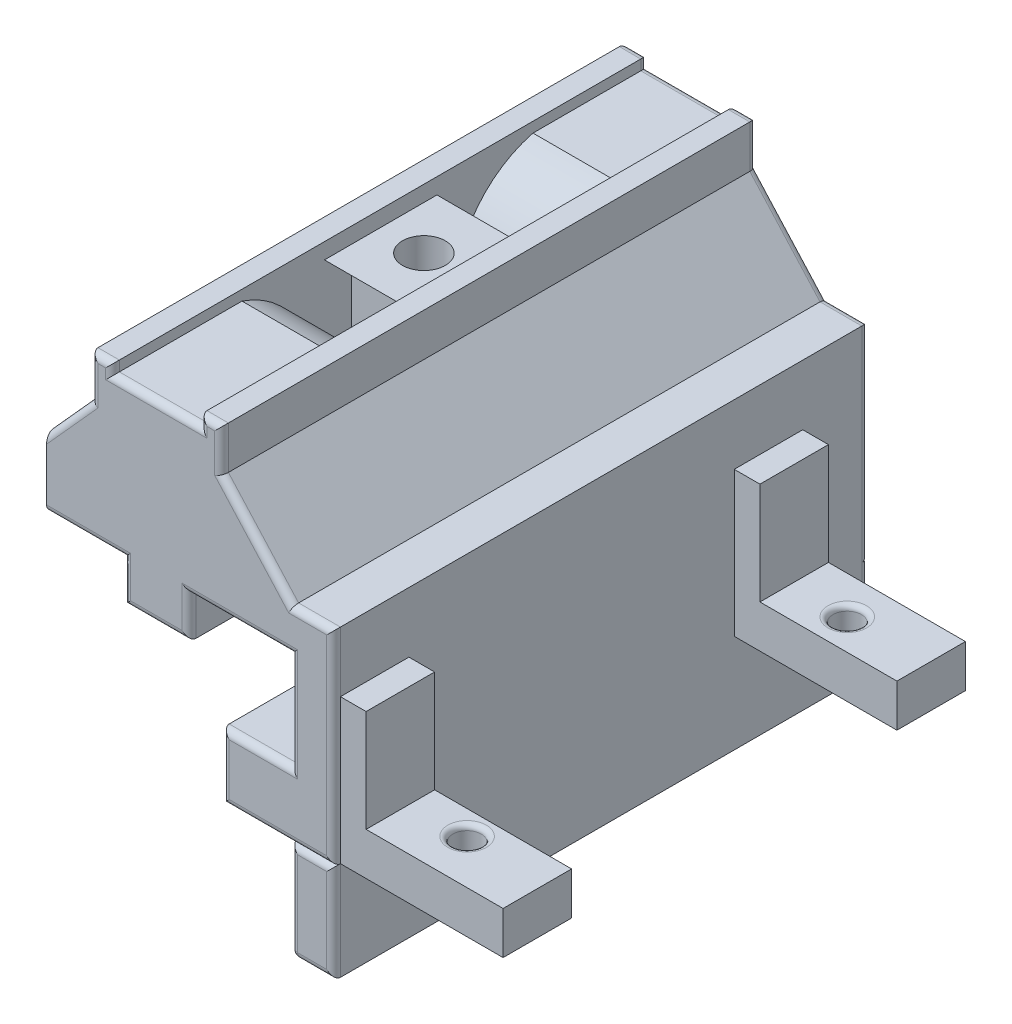
from build123d import *

# Parameters (mm, degrees)
BOSS_EXTRUDE1_DEPTH      = 39.6875
SKETCH3_R                = 1.5875
CUT_EXTRUDE1_DEPTH       = 39.6875
CUT_EXTRUDE3_DEPTH       = 5
CUT_EXTRUDE5_DEPTH       = 0.83
CUT_EXTRUDE5_DEPTH_BACK  = 5.67
FILLET1_R                = 0.508
SKETCH7_W                = 5.08
SKETCH7_H                = 10.72628101
BOSS_EXTRUDE2_DEPTH      = 1.905
SKETCH8_W                = 5.08
SKETCH8_H                = 3.15692897
BOSS_EXTRUDE3_DEPTH      = 10.16
CUT_EXTRUDE7_REACH       = 54.859
SKETCH9_R                = 1.05
FILLET2_R                = 0.381
CUT_EXTRUDE8_DEPTH       = 53.05177524
BOSS_EXTRUDE4_DEPTH      = 0.508
BOSS_EXTRUDE4_DEPTH_BACK = 39.1795
SKETCH11_W               = 3.175
SKETCH11_H               = 7.302
SKETCH11_W_2             = 4.84
SKETCH11_H_2             = 6.1
SKETCH11_W_3             = 5.720125627
SKETCH11_H_3             = 3.05
FILLET3_R                = 0.508
SKETCH13_W               = 4.84
SKETCH13_H               = 4.34094633
CUT_EXTRUDE10_DEPTH      = 3.048


with BuildPart() as part:
    # Sketch2 → Boss-Extrude1 (new body)
    with BuildSketch(Plane.XY):
        Polygon((-4.895, 3.02911179), (-9.97, 3.02911179), (-9.97, 10.33111179), (-2.42, 10.33111179), (-2.42, 7.28311179), (2.42, 7.28311179), (2.42, 10.33111179), (9.97, 10.33111179), (9.97, 3.02911179), (4.895, 3.02911179), (4.895, -1.82088821), (13.145, -1.82088821), (13.145, 13.37911179), (10.045, 13.37911179), (4.8375, 19.15761179), (4.8375, 22.33261179), (3.25, 22.33261179), (3.25, 21.57061179), (-3.25, 21.57061179), (-3.25, 22.33261179), (-4.8375, 22.33261179), (-4.8375, 19.15761179), (-10.045, 13.37911179), (-13.145, 13.37911179), (-13.145, -1.82088821), (-4.895, -1.82088821), align=None)
    extrude(amount=BOSS_EXTRUDE1_DEPTH)

    # Sketch3 → Cut-Extrude1 (cut)
    with BuildSketch(Plane(origin=(0, 21.57061179, 0), x_dir=(1, 0, 0), z_dir=(0, 1, 0))):
        with Locations(Location((0, -19.84375, 0), (0, 0, 270))):
            Circle(SKETCH3_R)
    extrude(amount=-CUT_EXTRUDE1_DEPTH, mode=Mode.SUBTRACT)

    # Sketch4 → Cut-Extrude3 (cut)
    with BuildSketch(Plane.XZ.offset(-7.28311179)):
        Polygon((1.760918321, 16.79375), (3.521836642, 19.84375), (1.760918321, 22.89375), (-1.760918321, 22.89375), (-3.521836642, 19.84375), (-1.760918321, 16.79375), align=None)
    extrude(amount=-CUT_EXTRUDE3_DEPTH, mode=Mode.SUBTRACT)

    # Sketch5 → Cut-Extrude5 (cut, two sides: drawn at the far end of the back side and taken through both)
    with BuildSketch(Plane.ZY.offset(2.42).offset(-CUT_EXTRUDE5_DEPTH_BACK)):
        with BuildLine():
            Line((21.966982917, 7.15761179), (21.966982917, 19.15761179))
            Line((21.966982917, 19.15761179), (23.966982917, 21.15761179))
            Line((23.966982917, 21.15761179), (15.626036587, 21.15761179))
            Line((15.626036587, 21.15761179), (17.626036587, 19.15761179))
            Line((17.626036587, 19.15761179), (17.626036587, 7.15761179))
            Line((17.626036587, 7.15761179), (9.473965766, 7.15761179))
            ThreePointArc((9.473965766, 7.15761179), (14.101249798, 15.593648004), (6.752192324, 21.804108435))
            Line((6.752192324, 21.804108435), (30.939378373, 21.804108435))
            ThreePointArc((30.939378373, 21.804108435), (24.928421122, 14.794550832), (30.119053738, 7.15761179))
            Line((30.119053738, 7.15761179), (21.966982917, 7.15761179))
        make_face()
    extrude(amount=CUT_EXTRUDE5_DEPTH + CUT_EXTRUDE5_DEPTH_BACK, mode=Mode.SUBTRACT)

    # Fillet1
    fillet1_edges = [part.edges().sort_by_distance(p)[0] for p in [
        (-13.145, 5.77911179, 39.6875),
        (-9.02, -1.82088821, 39.6875),
        (-9.97, 6.68011179, 39.6875),
        (-6.195, 10.33111179, 39.6875),
        (-2.42, 8.80711179, 39.6875),
        (-9.02, -1.82088821, 0),
        (0, 7.28311179, 39.6875),
        (-13.145, 5.77911179, 0),
        (-11.595, 13.37911179, 0),
        (-7.44125, 16.26836179, 0),
        (-4.8375, 20.74511179, 0),
        (-4.04375, 22.33261179, 0),
        (-3.25, 21.95161179, 0),
        (0, 21.57061179, 0),
        (3.25, 21.95161179, 0),
        (4.04375, 22.33261179, 0),
        (4.8375, 20.74511179, 0),
        (2.42, 8.80711179, 39.6875),
        (7.44125, 16.26836179, 0),
        (11.595, 13.37911179, 0),
        (13.145, 5.77911179, 0),
        (9.02, -1.82088821, 0),
        (4.895, 0.60411179, 0),
        (7.4325, 3.02911179, 0),
        (9.97, 6.68011179, 0),
        (6.195, 10.33111179, 0),
        (2.42, 8.80711179, 0),
        (0, 7.28311179, 0),
        (6.195, 10.33111179, 39.6875),
        (-2.42, 8.80711179, 0),
        (-6.195, 10.33111179, 0),
        (-9.97, 6.68011179, 0),
        (-7.4325, 3.02911179, 0),
        (-4.895, 0.60411179, 0),
        (9.97, 6.68011179, 39.6875),
        (7.4325, 3.02911179, 39.6875),
        (4.895, 0.60411179, 39.6875),
        (9.02, -1.82088821, 39.6875),
        (-4.895, 0.60411179, 39.6875),
        (13.145, 5.77911179, 39.6875),
        (11.595, 13.37911179, 39.6875),
        (7.44125, 16.26836179, 39.6875),
        (4.8375, 20.74511179, 39.6875),
        (4.04375, 22.33261179, 39.6875),
        (3.25, 21.95161179, 39.6875),
        (0, 21.57061179, 39.6875),
        (-3.25, 21.95161179, 39.6875),
        (-4.04375, 22.33261179, 39.6875),
        (-4.8375, 20.74511179, 39.6875),
        (-7.4325, 3.02911179, 39.6875),
        (-7.44125, 16.26836179, 39.6875),
        (-11.595, 13.37911179, 39.6875),
    ]]
    fillet(fillet1_edges, radius=FILLET1_R)

    # Sketch7 → Boss-Extrude2 (add)
    with BuildSketch(Plane(origin=(13.145, 0, 0), x_dir=(0, 0, -1), z_dir=(1, 0, 0))):
        with Locations((-36.6395, 3.542252295)):
            Rectangle(SKETCH7_W, SKETCH7_H)
        with Locations((-7.4295, 3.542252295)):
            Rectangle(SKETCH7_W, SKETCH7_H)
    extrude(amount=BOSS_EXTRUDE2_DEPTH)

    # Sketch8 → Boss-Extrude3 (add)
    with BuildSketch(Plane(origin=(15.05, 0, 0), x_dir=(0, 0, -1), z_dir=(1, 0, 0))):
        with Locations((-36.6395, -0.242423725)):
            Rectangle(SKETCH8_W, SKETCH8_H)
        with Locations((-7.4295, -0.242423725)):
            Rectangle(SKETCH8_W, SKETCH8_H)
    extrude(amount=BOSS_EXTRUDE3_DEPTH)

    # Sketch9 → Cut-Extrude7 (cut, up to next)
    with BuildSketch(Plane.XZ.offset(1.82088821), mode=Mode.PRIVATE) as cut_extrude7_sk1:
        with Locations((19.241, 35.8775)):
            Circle(SKETCH9_R)
    cut_extrude7_tool1 = extrude(cut_extrude7_sk1.sketch, amount=-CUT_EXTRUDE7_REACH, mode=Mode.PRIVATE) & part.part
    # Sketch9 → Cut-Extrude7 (cut, up to next)
    with BuildSketch(Plane.XZ.offset(1.82088821), mode=Mode.PRIVATE) as cut_extrude7_sk2:
        with Locations((19.241, 7.6835)):
            Circle(SKETCH9_R)
    cut_extrude7_tool2 = extrude(cut_extrude7_sk2.sketch, amount=-CUT_EXTRUDE7_REACH, mode=Mode.PRIVATE) & part.part
    add(cut_extrude7_tool1.solids().sort_by_distance((19.241, -1.820888, 35.8775))[0], mode=Mode.SUBTRACT)
    add(cut_extrude7_tool2.solids().sort_by_distance((19.241, -1.820888, 7.6835))[0], mode=Mode.SUBTRACT)

    # Fillet2
    fillet2_edges = [part.edges().sort_by_distance(p)[0] for p in [
        (18.191, 1.33604076, 35.8775),
        (18.191, -1.82088821, 35.8775),
        (18.191, 1.33604076, 7.6835),
        (18.191, -1.82088821, 7.6835),
    ]]
    fillet(fillet2_edges, radius=FILLET2_R)

    # Sketch10 → Cut-Extrude8 (cut, through all)
    with BuildSketch(Plane.XY.offset(39.6875)):
        Polygon((-8.140125627, 16.556662615), (-13.795, 16.556662615), (-15.501836838, 16.556662615), (-15.501836838, 5.924292452), (-8.140125627, 5.924292452), align=None)
        Polygon((-4.124785379, 5.924292452), (-8.140125627, 5.924292452), (-15.501836838, 5.924292452), (-15.501836838, -4.367210951), (-4.124785379, -4.367210951), align=None)
    extrude(amount=-CUT_EXTRUDE8_DEPTH, mode=Mode.SUBTRACT)

    # Sketch11 → Boss-Extrude4 (add, two sides: drawn at the far end of the back side and taken through both)
    with BuildSketch(Plane.XY.offset(39.1795).offset(-BOSS_EXTRUDE4_DEPTH_BACK)):
        with Locations((11.5575, -5.47188821)):
            Rectangle(SKETCH11_W, SKETCH11_H)
        with Locations((0, -9.12288821)):
            Rectangle(SKETCH11_W_2, SKETCH11_H_2)
        with Locations((-5.280062813, -10.64788821)):
            Rectangle(SKETCH11_W_3, SKETCH11_H_3)
    extrude(amount=BOSS_EXTRUDE4_DEPTH + BOSS_EXTRUDE4_DEPTH_BACK)


with BuildPart() as boss_extrude4_kept_piece:
    # of the separate pieces the step leaves, the one the design keeps (boss_extrude4_pieces_kept)
    add(part.part.solids().sort_by_distance((4.895, -1.82088821, 0.508))[0])

    # Fillet3
    fillet3_edges = [boss_extrude4_kept_piece.edges().sort_by_distance(p)[0] for p in [
        (11.5575, -9.12288821, 39.6875),
        (9.97, -9.12288821, 19.84375),
        (11.5575, -9.12288821, 0),
        (9.97, -5.47188821, 0),
        (13.145, -5.47188821, 0),
        (13.145, -5.47188821, 39.6875),
        (9.97, -5.47188821, 39.6875),
        (11.5575, -1.82088821, 39.6875),
        (11.5575, -1.82088821, 0),
    ]]
    fillet(fillet3_edges, radius=FILLET3_R - 0.0001)  # a hair under: the kernel refuses the full size

    # Sketch13 → Cut-Extrude10 (cut)
    with BuildSketch(Plane.XZ.offset(-7.28311179)):
        with Locations((0, 19.796509752)):
            Rectangle(SKETCH13_W, SKETCH13_H)
    extrude(amount=-CUT_EXTRUDE10_DEPTH, mode=Mode.SUBTRACT)


solid = boss_extrude4_kept_piece.part
